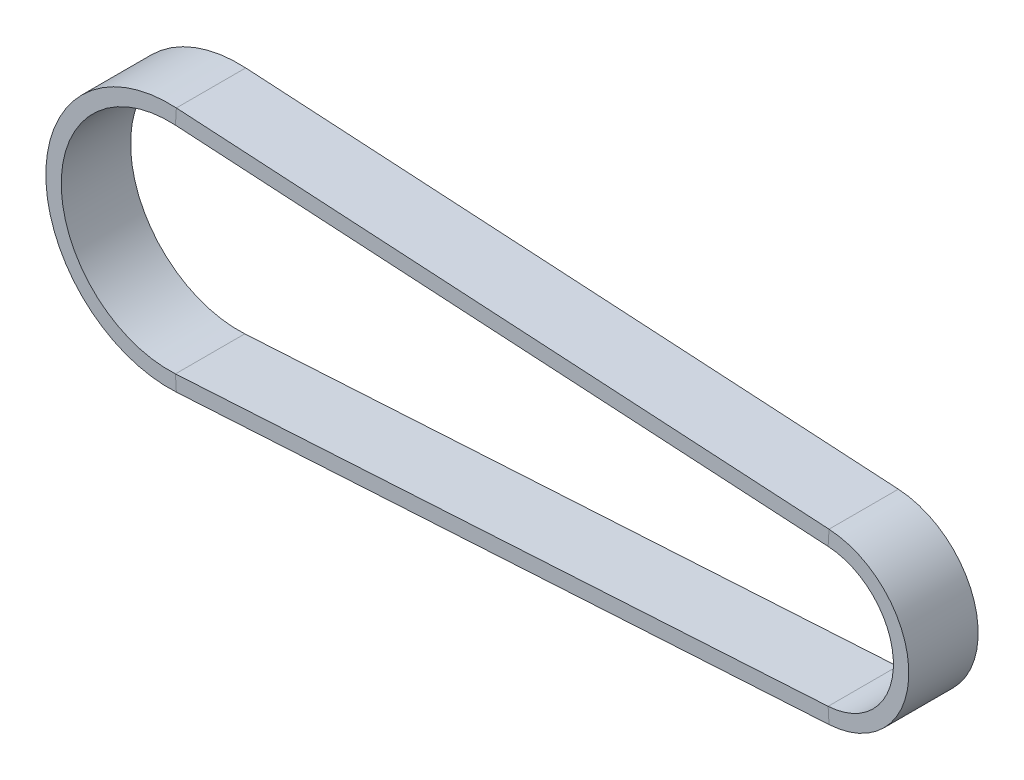
from build123d import *

# Parameters (mm, degrees)
SKIZZE2_W = 2
SKIZZE2_H = 9


with BuildPart() as part:
    # Austragung1: sweep along a path in Skizze3
    with BuildLine(Plane.XY.offset(15.5)) as austragung1_path:
        ThreePointArc((-15, 0), (-10.289915109, 10.914103127), (0.882352941, 14.974025955))
        Line((0.882352941, 14.974025955), (85.588235294, 9.98268397))
        ThreePointArc((85.588235294, 9.98268397), (92.276068751, 6.859943406), (95, 0))
    # Skizze2 → Austragung1 (sweep)
    with BuildSketch(Plane(origin=(0, 0, 0), x_dir=(1, 0, 0), z_dir=(0, 1, 0))):
        with Locations((-15, -15.5)):
            Rectangle(SKIZZE2_W, SKIZZE2_H)
    sweep(path=austragung1_path.line)

    # Spiegeln1: part across plane


with BuildPart() as part_1:
    add(part.part)
    add(part.part.mirror(Plane(origin=(0, 0, 0), x_dir=(0, 0, 1), z_dir=(0, -1, 0))))


solid = part_1.part
